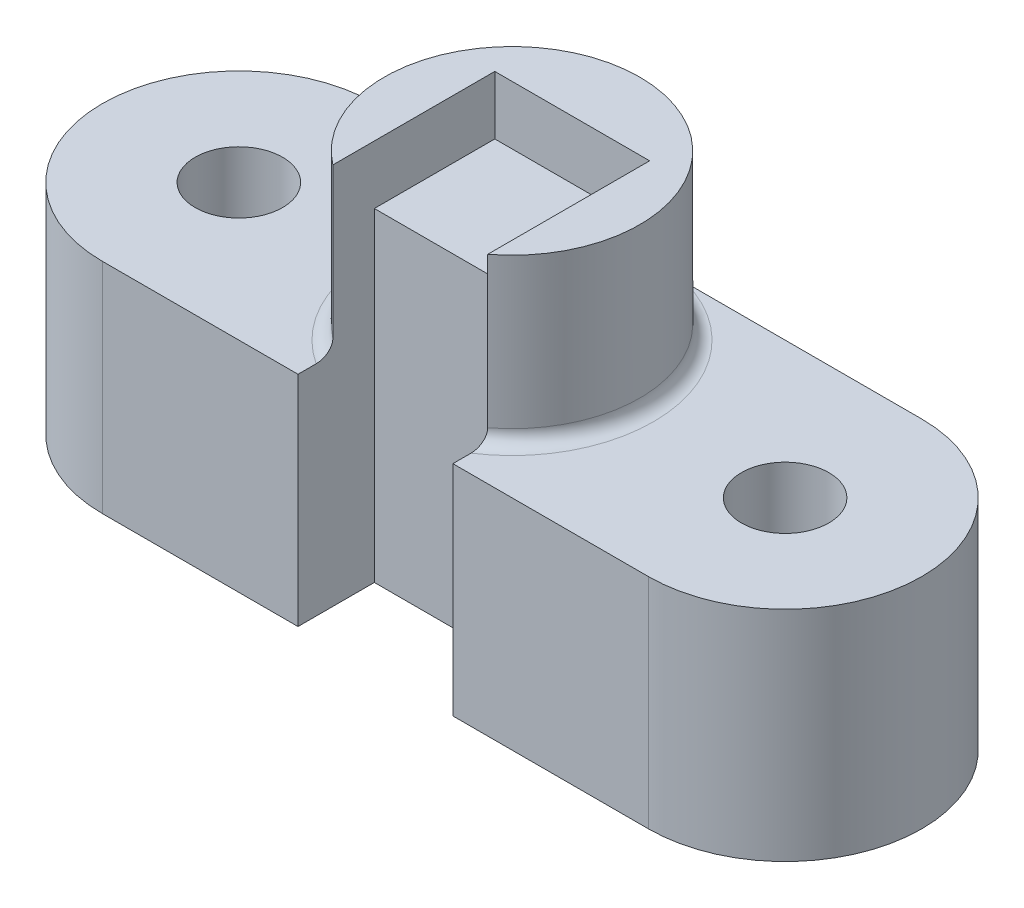
from build123d import *

# Parameters (mm, degrees)
SKETCH2_R           = 1.27
BOSS_EXTRUDE1_DEPTH = 6.35
SKETCH3_R           = 3.71475
BOSS_EXTRUDE2_DEPTH = 4.7625
FILLET1_R           = 0.396875
SKETCH4_W           = 4.5
SKETCH4_H           = 3.5
CUT_EXTRUDE1_DEPTH  = 1.7
SKETCH5_W           = 4.5
SKETCH5_H           = 11.1125
CUT_EXTRUDE2_DEPTH  = 15.655558435


with BuildPart() as part:
    # Sketch2 → Boss-Extrude1 (new body)
    with BuildSketch(Plane(origin=(0, 0, 0), x_dir=(1, 0, 0), z_dir=(0, 1, 0))):
        with BuildLine():
            Line((-7.9375, 3.96875), (7.9375, 3.96875))
            ThreePointArc((7.9375, 3.96875), (11.90625, 0), (7.9375, -3.96875))
            Line((7.9375, -3.96875), (-7.9375, -3.96875))
            ThreePointArc((-7.9375, -3.96875), (-11.90625, 0), (-7.9375, 3.96875))
        make_face()
        with Locations((-7.9375, 0)):
            Circle(SKETCH2_R, mode=Mode.SUBTRACT)
        with Locations((7.9375, 0)):
            Circle(SKETCH2_R, mode=Mode.SUBTRACT)
    extrude(amount=-BOSS_EXTRUDE1_DEPTH)

    # Sketch3 → Boss-Extrude2 (add)
    with BuildSketch(Plane(origin=(0, 0, 0), x_dir=(1, 0, 0), z_dir=(0, 1, 0))):
        Circle(SKETCH3_R)
    extrude(amount=BOSS_EXTRUDE2_DEPTH)

    # Fillet1
    fillet1_edges = [part.edges().sort_by_distance(p)[0] for p in [
        (-3.71475, 0, 0),
    ]]
    fillet(fillet1_edges, radius=FILLET1_R)

    # Sketch4 → Cut-Extrude1 (cut)
    with BuildSketch(Plane(origin=(0, 4.7625, 0), x_dir=(1, 0, 0), z_dir=(0, 1, 0))):
        Rectangle(SKETCH4_W, SKETCH4_H)
    extrude(amount=-CUT_EXTRUDE1_DEPTH, mode=Mode.SUBTRACT)

    # Sketch5 → Cut-Extrude2 (cut, through all)
    with BuildSketch(Plane(origin=(0, 0, 1.75), x_dir=(-1, 0, 0), z_dir=(0, 0, -1))):
        with Locations((0, -0.79375)):
            Rectangle(SKETCH5_W, SKETCH5_H)
    extrude(amount=-CUT_EXTRUDE2_DEPTH, mode=Mode.SUBTRACT)


solid = part.part
